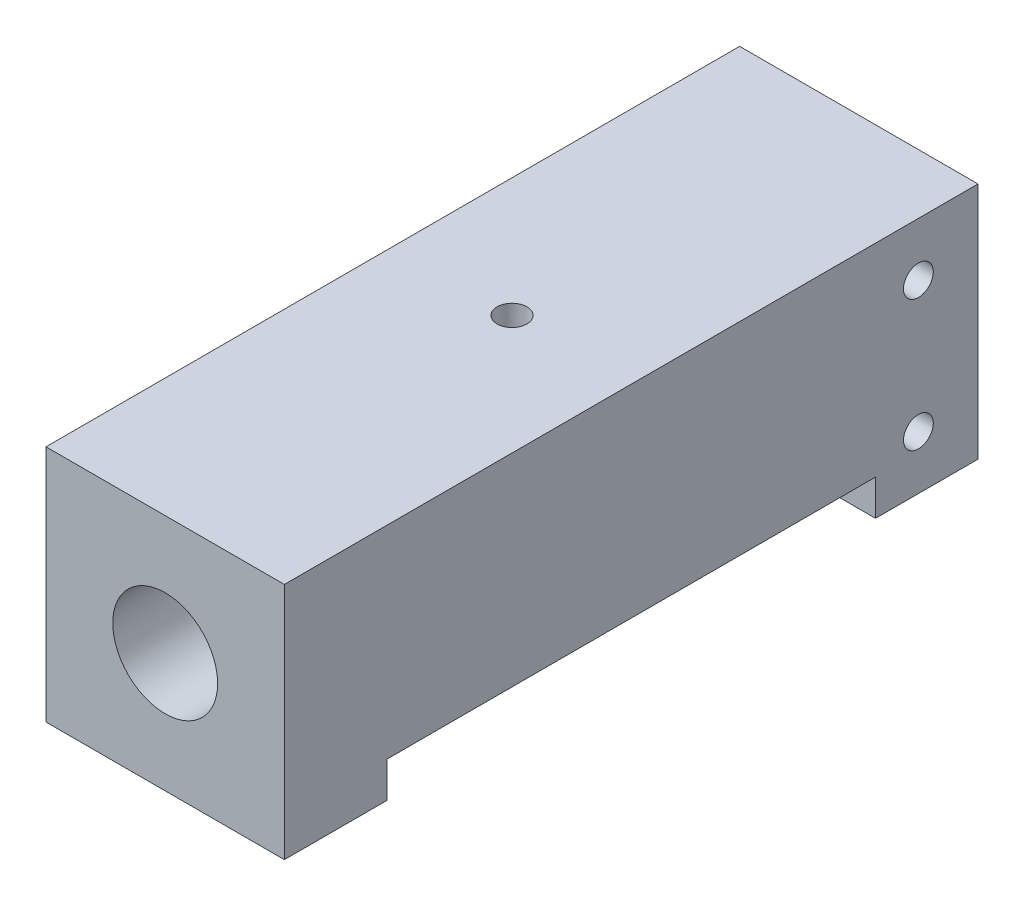
from build123d import *

# Parameters (mm, degrees)
SCHIZZO1_W                   = 20
SCHIZZO1_H                   = 20
ESTRUSIONE_ESTRUSIONE1_DEPTH = 58.2
SCHIZZO2_R                   = 3
TAGLIO_ESTRUSIONE1_DEPTH     = 60.893572276
FORO_FILETTATO_G1_8_1_D      = 8.8
FORO_FILETTATO_G1_8_1_DEPTH  = 10
FORO_FILETTATO_G1_8_1_TIP    = 2.643786724
M3_TAPPED_HOLE2_D            = 2.5
M3_TAPPED_HOLE2_DEPTH        = 5
M3_TAPPED_HOLE2_TIP          = 0.751075774
M3_TAPPED_HOLE3_D            = 2.5
SKETCH1_W                    = 36.2
SKETCH1_H                    = 6
BOSS_EXTRUDE1_DEPTH          = 4.9
CUT_EXTRUDE1_DEPTH           = 65.087830449
M3_TAPPED_HOLE4_D            = 2.5
M3_TAPPED_HOLE4_DEPTH        = 20
M3_TAPPED_HOLE4_TIP          = 0.751075774


with BuildPart() as part:
    # Schizzo1 → Estrusione-Estrusione1 (new body)
    with BuildSketch(Plane.XY):
        Rectangle(SCHIZZO1_W, SCHIZZO1_H)
    extrude(amount=-ESTRUSIONE_ESTRUSIONE1_DEPTH)

    # Schizzo2 → Taglio-Estrusione1 (cut, through all)
    with BuildSketch(Plane(origin=(0, 0, -58.2), x_dir=(-1, 0, 0), z_dir=(0, 0, -1))):
        Circle(SCHIZZO2_R)
    extrude(amount=-TAGLIO_ESTRUSIONE1_DEPTH, mode=Mode.SUBTRACT)

    # Foro filettato G1/8-1
    with Locations(Plane.XY):
        with Locations((0, 0)):
            Hole(FORO_FILETTATO_G1_8_1_D / 2, depth=FORO_FILETTATO_G1_8_1_DEPTH)
            with Locations((0, 0, -(FORO_FILETTATO_G1_8_1_DEPTH + FORO_FILETTATO_G1_8_1_TIP / 2))):  # 118° drill point
                Cone(0, FORO_FILETTATO_G1_8_1_D / 2, FORO_FILETTATO_G1_8_1_TIP, mode=Mode.SUBTRACT)

    # M3 Tapped Hole2
    with Locations(Plane(origin=(0, 10, -29.1), x_dir=(1, 0, 0), z_dir=(0, 1, 0))):
        with Locations((0, 0)):
            Hole(M3_TAPPED_HOLE2_D / 2, depth=M3_TAPPED_HOLE2_DEPTH)
            with Locations((0, 0, -(M3_TAPPED_HOLE2_DEPTH + M3_TAPPED_HOLE2_TIP / 2))):  # 118° drill point
                Cone(0, M3_TAPPED_HOLE2_D / 2, M3_TAPPED_HOLE2_TIP, mode=Mode.SUBTRACT)

    # Schizzo14 → Foro Ø16.0 (16)-1 (revolve, cut)
    with BuildSketch(Plane(origin=(0, 0, -58.2), x_dir=(0, 1, 0), z_dir=(1, 0, 0))):
        Polygon((0, 0), (0, 16.806884952), (8, 12), (8, 0), align=None)
    revolve(axis=Axis((0, 0, -64.55), (0, 0, 1)), mode=Mode.SUBTRACT)

    # M3 Tapped Hole3 (through all)
    with Locations(Plane(origin=(10, 5.5, -53.2), x_dir=(0, 0, 1), z_dir=(1, 0, 0))):
        with Locations((0, 0), (0, 11)):
            Hole(M3_TAPPED_HOLE3_D / 2)

    # Sketch1 → Boss-Extrude1 (add)
    with BuildSketch(Plane.ZY.offset(10)):
        with Locations((-40.1, 0)):
            Rectangle(SKETCH1_W, SKETCH1_H)
    extrude(amount=BOSS_EXTRUDE1_DEPTH)

    # Sketch2 → Cut-Extrude1 (cut, through all)
    with BuildSketch(Plane(origin=(10, 0, 0), x_dir=(0, 0, -1), z_dir=(1, 0, 0))):
        Polygon((49.6, -10), (33.6, -10), (8.6, -10), (8.6, -7), (33.6, -7), (49.6, -7), align=None)
    extrude(amount=-CUT_EXTRUDE1_DEPTH, mode=Mode.SUBTRACT)

    # M3 Tapped Hole4
    with Locations(Plane.XY.offset(-22)):
        with Locations((-13, 0)):
            Hole(M3_TAPPED_HOLE4_D / 2, depth=M3_TAPPED_HOLE4_DEPTH)
            with Locations((0, 0, -(M3_TAPPED_HOLE4_DEPTH + M3_TAPPED_HOLE4_TIP / 2))):  # 118° drill point
                Cone(0, M3_TAPPED_HOLE4_D / 2, M3_TAPPED_HOLE4_TIP, mode=Mode.SUBTRACT)


solid = part.part
